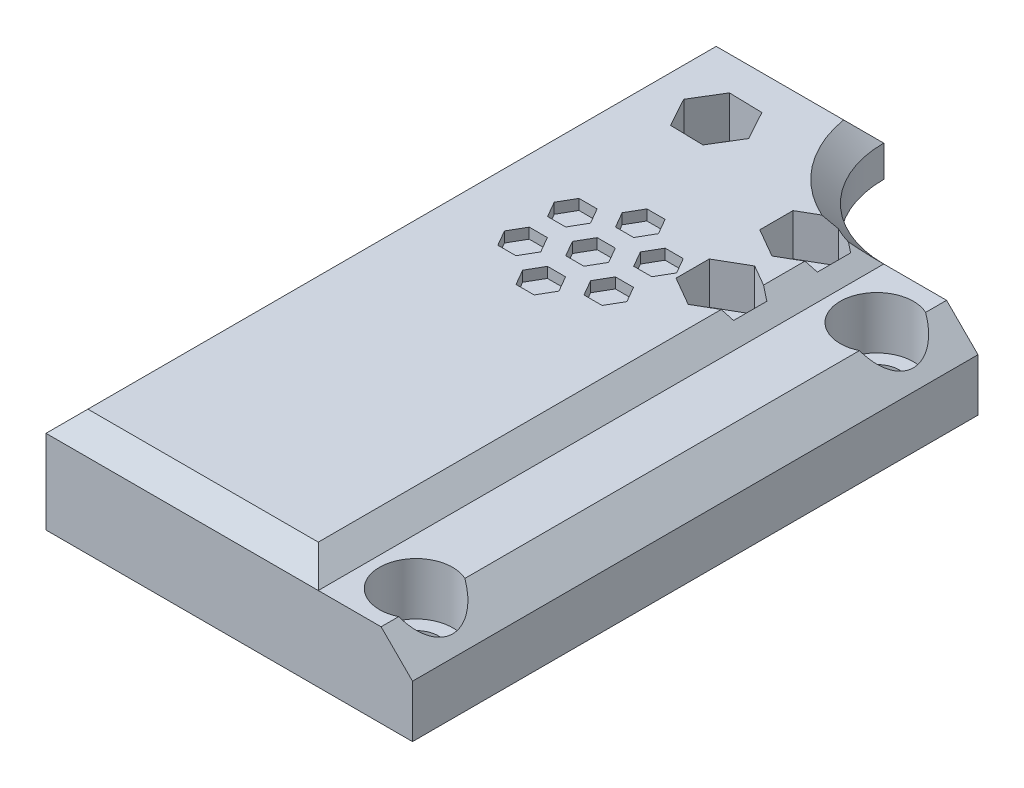
from build123d import *

# Parameters (mm, degrees)
SKETCH1_W           = 26
SKETCH1_H           = 39
BOSS_EXTRUDE1_DEPTH = 10
SKETCH2_W           = 26
SKETCH2_H           = 5
BOSS_EXTRUDE2_DEPTH = 25
CUT_EXTRUDE1_REACH  = 71.8
CHAMFER1_SIZE       = 2
SKETCH4_W           = 54
SKETCH4_H           = 8
BOSS_EXTRUDE3_DEPTH = 9
CUT_EXTRUDE2_REACH  = 71.541
SKETCH5_R           = 2.15
SKETCH6_R           = 3.5
CUT_EXTRUDE3_DEPTH  = 5
CHAMFER3_SIZE       = 3
CUT_EXTRUDE5_DEPTH  = 1
CUT_EXTRUDE6_DEPTH  = 4
CUT_EXTRUDE7_REACH  = 71.8
SKETCH12_R          = 1.65
SKETCH14_W          = 12
SKETCH14_H          = 12
CUT_EXTRUDE9_DEPTH  = 7
SKETCH15_W          = 37.46707609
SKETCH15_H          = 12.719450185
CUT_EXTRUDE10_DEPTH = 89.977525252
SKETCH16_W          = 5
SKETCH16_H          = 12
CUT_EXTRUDE11_DEPTH = 7


with BuildPart() as part:
    # Sketch1 → Boss-Extrude1 (new body)
    with BuildSketch(Plane(origin=(0, 0, 0), x_dir=(1, 0, 0), z_dir=(0, 1, 0))):
        with Locations((13, 19.5)):
            Rectangle(SKETCH1_W, SKETCH1_H)
    extrude(amount=BOSS_EXTRUDE1_DEPTH)

    # Sketch2 → Boss-Extrude2 (add)
    with BuildSketch(Plane(origin=(0, 0, -39), x_dir=(-1, 0, 0), z_dir=(0, 0, -1))):
        with Locations((-13, 7.5)):
            Rectangle(SKETCH2_W, SKETCH2_H)
    extrude(amount=BOSS_EXTRUDE2_DEPTH)

    # Sketch3 → Cut-Extrude1 (cut, up to next)
    with BuildSketch(Plane(origin=(0, 10, 0), x_dir=(1, 0, 0), z_dir=(0, 1, 0)), mode=Mode.PRIVATE) as cut_extrude1_sk1:
        with BuildLine():
            Line((0, 54), (0, 64))
            Line((0, 64), (10, 64))
            ThreePointArc((10, 64), (7.071067812, 56.928932188), (0, 54))
        make_face()
    cut_extrude1_tool1 = extrude(cut_extrude1_sk1.sketch, amount=-CUT_EXTRUDE1_REACH, mode=Mode.PRIVATE) & part.part
    add(cut_extrude1_tool1.solids().sort_by_distance((4.244132, 10, -59.755868))[0], mode=Mode.SUBTRACT)

    # Chamfer1
    chamfer1_edges = [part.edges().sort_by_distance(p)[0] for p in [
        (26, 10, -32),
        (18, 10, -64),
        (0, 10, -27),
        (7.071067812, 10, -56.928932188),
        (13, 10, 0),
    ]]
    chamfer(chamfer1_edges, length=CHAMFER1_SIZE)

    # Sketch4 → Boss-Extrude3 (add)
    with BuildSketch(Plane.ZY):
        with Locations((-27, 4)):
            Rectangle(SKETCH4_W, SKETCH4_H)
    extrude(amount=BOSS_EXTRUDE3_DEPTH)

    # Sketch5 → Cut-Extrude2 (cut, up to next)
    with BuildSketch(Plane(origin=(0, 8, 0), x_dir=(1, 0, 0), z_dir=(0, 1, 0)), mode=Mode.PRIVATE) as cut_extrude2_sk1:
        with Locations(Location((-4.5, 48.837478231, 0), (0, 0, 270))):
            Circle(SKETCH5_R)
    cut_extrude2_tool1 = extrude(cut_extrude2_sk1.sketch, amount=-CUT_EXTRUDE2_REACH, mode=Mode.PRIVATE) & part.part
    # Sketch5 → Cut-Extrude2 (cut, up to next)
    with BuildSketch(Plane(origin=(0, 8, 0), x_dir=(1, 0, 0), z_dir=(0, 1, 0)), mode=Mode.PRIVATE) as cut_extrude2_sk2:
        with Locations(Location((-4.5, 4.837478231, 0), (0, 0, 270))):
            Circle(SKETCH5_R)
    cut_extrude2_tool2 = extrude(cut_extrude2_sk2.sketch, amount=-CUT_EXTRUDE2_REACH, mode=Mode.PRIVATE) & part.part
    add(cut_extrude2_tool1.solids().sort_by_distance((-4.5, 8, -48.837478))[0], mode=Mode.SUBTRACT)
    add(cut_extrude2_tool2.solids().sort_by_distance((-4.5, 8, -4.837478))[0], mode=Mode.SUBTRACT)

    # Sketch6 → Cut-Extrude3 (cut)
    with BuildSketch(Plane(origin=(0, 8, 0), x_dir=(1, 0, 0), z_dir=(0, 1, 0))):
        with Locations(Location((-4.5, 48.837478231, 0), (0, 0, 270))):
            Circle(SKETCH6_R)
        with Locations(Location((-4.5, 4.837478231, 0), (0, 0, 270))):
            Circle(SKETCH6_R)
    extrude(amount=-CUT_EXTRUDE3_DEPTH, mode=Mode.SUBTRACT)

    # Chamfer3
    # the kernel refuses this chamfer: 3 mm, written as the material it takes off along each edge
    with BuildSketch(Plane(origin=(-9, 8, -61.715048964), x_dir=(-0.0274958766105862, -0.9996219169112968, 0), z_dir=(0, 0, 1))) as chamfer3_piece_1:
        Polygon((CHAMFER3_SIZE * 0.999621916911, CHAMFER3_SIZE * 0.0274958766106), (-CHAMFER3_SIZE * 0.0274958766106, CHAMFER3_SIZE * 0.999621916911), (0, 0), align=None)
    extrude(amount=69.430097928, mode=Mode.SUBTRACT)

    # Sketch10 → Cut-Extrude5 (cut)
    with BuildSketch(Plane(origin=(0, 10, 0), x_dir=(1, 0, 0), z_dir=(0, 1, 0))):
        Polygon((14.732050808, 39), (13.866025404, 40.5), (12.133974596, 40.5), (11.267949192, 39), (12.133974596, 37.5), (13.866025404, 37.5), align=None)
        Polygon((14.732050808, 43.75), (13.866025404, 45.25), (12.133974596, 45.25), (11.267949192, 43.75), (12.133974596, 42.25), (13.866025404, 42.25), align=None)
        Polygon((17.979646072, 39.875), (18.845671476, 41.375), (17.979646072, 42.875), (16.247595264, 42.875), (15.38156986, 41.375), (16.247595264, 39.875), align=None)
        Polygon((16.247595264, 35.125), (17.979646072, 35.125), (18.845671476, 36.625), (17.979646072, 38.125), (16.247595264, 38.125), (15.38156986, 36.625), align=None)
        Polygon((11.267949192, 34.25), (12.133974596, 32.75), (13.866025404, 32.75), (14.732050808, 34.25), (13.866025404, 35.75), (12.133974596, 35.75), align=None)
        Polygon((8.020353928, 38.125), (7.154328524, 36.625), (8.020353928, 35.125), (9.752404736, 35.125), (10.61843014, 36.625), (9.752404736, 38.125), align=None)
        Polygon((9.752404736, 42.875), (8.020353928, 42.875), (7.154328524, 41.375), (8.020353928, 39.875), (9.752404736, 39.875), (10.61843014, 41.375), align=None)
    extrude(amount=-CUT_EXTRUDE5_DEPTH, mode=Mode.SUBTRACT)

    # Sketch11 → Cut-Extrude6 (cut)
    with BuildSketch(Plane(origin=(0, 10, 0), x_dir=(1, 0, 0), z_dir=(0, 1, 0))):
        Polygon((6.75, 44.08771324), (4, 45.675426481), (1.25, 44.08771324), (1.25, 40.91228676), (4, 39.324573519), (6.75, 40.91228676), align=None)
        Polygon((6.75, 52.08771324), (4, 53.675426481), (1.25, 52.08771324), (1.25, 48.91228676), (4, 47.324573519), (6.75, 48.91228676), align=None)
        Polygon((21.174508901, 56.076331968), (19.521149027, 58.787371337), (16.346640126, 58.711039369), (14.825491099, 55.923668032), (16.478850973, 53.212628663), (19.653359874, 53.288960631), align=None)
    extrude(amount=-CUT_EXTRUDE6_DEPTH, mode=Mode.SUBTRACT)

    # Sketch12 → Cut-Extrude7 (cut, up to next)
    with BuildSketch(Plane(origin=(0, 10, 0), x_dir=(1, 0, 0), z_dir=(0, 1, 0)), mode=Mode.PRIVATE) as cut_extrude7_sk1:
        with Locations(Location((4, 50.5, 0), (0, 0, 270))):
            Circle(SKETCH12_R)
    cut_extrude7_tool1 = extrude(cut_extrude7_sk1.sketch, amount=-CUT_EXTRUDE7_REACH, mode=Mode.PRIVATE) & part.part
    # Sketch12 → Cut-Extrude7 (cut, up to next)
    with BuildSketch(Plane(origin=(0, 10, 0), x_dir=(1, 0, 0), z_dir=(0, 1, 0)), mode=Mode.PRIVATE) as cut_extrude7_sk2:
        with Locations(Location((4, 42.5, 0), (0, 0, 270))):
            Circle(SKETCH12_R)
    cut_extrude7_tool2 = extrude(cut_extrude7_sk2.sketch, amount=-CUT_EXTRUDE7_REACH, mode=Mode.PRIVATE) & part.part
    # Sketch12 → Cut-Extrude7 (cut, up to next)
    with BuildSketch(Plane(origin=(0, 10, 0), x_dir=(1, 0, 0), z_dir=(0, 1, 0)), mode=Mode.PRIVATE) as cut_extrude7_sk3:
        with Locations(Location((18, 56, 0), (0, 0, 270))):
            Circle(SKETCH12_R)
    cut_extrude7_tool3 = extrude(cut_extrude7_sk3.sketch, amount=-CUT_EXTRUDE7_REACH, mode=Mode.PRIVATE) & part.part
    add(cut_extrude7_tool1.solids().sort_by_distance((4, 10, -50.5))[0], mode=Mode.SUBTRACT)
    add(cut_extrude7_tool2.solids().sort_by_distance((4, 10, -42.5))[0], mode=Mode.SUBTRACT)
    add(cut_extrude7_tool3.solids().sort_by_distance((18, 10, -56))[0], mode=Mode.SUBTRACT)

    # Sketch14 → Cut-Extrude9 (cut)
    with BuildSketch(Plane.XZ):
        with Locations((18.75, -23)):
            Rectangle(SKETCH14_W, SKETCH14_H)
    extrude(amount=-CUT_EXTRUDE9_DEPTH, mode=Mode.SUBTRACT)

    # Mirror3: part across plane


with BuildPart() as part_1:
    add(part.part)
    add(part.part.mirror(Plane(origin=(26, 0, 0), x_dir=(0, 0, 1), z_dir=(1, 0, 0))))

    # Sketch15 → Cut-Extrude10 (cut, through all)
    with BuildSketch(Plane.XY):
        with Locations((7.266461955, 6.359725093)):
            Rectangle(SKETCH15_W, SKETCH15_H)
    extrude(amount=-CUT_EXTRUDE10_DEPTH, mode=Mode.SUBTRACT)

    # Sketch16 → Cut-Extrude11 (cut)
    with BuildSketch(Plane.XZ):
        with Locations((41.75, -23)):
            Rectangle(SKETCH16_W, SKETCH16_H)
    extrude(amount=-CUT_EXTRUDE11_DEPTH, mode=Mode.SUBTRACT)


solid = part_1.part
